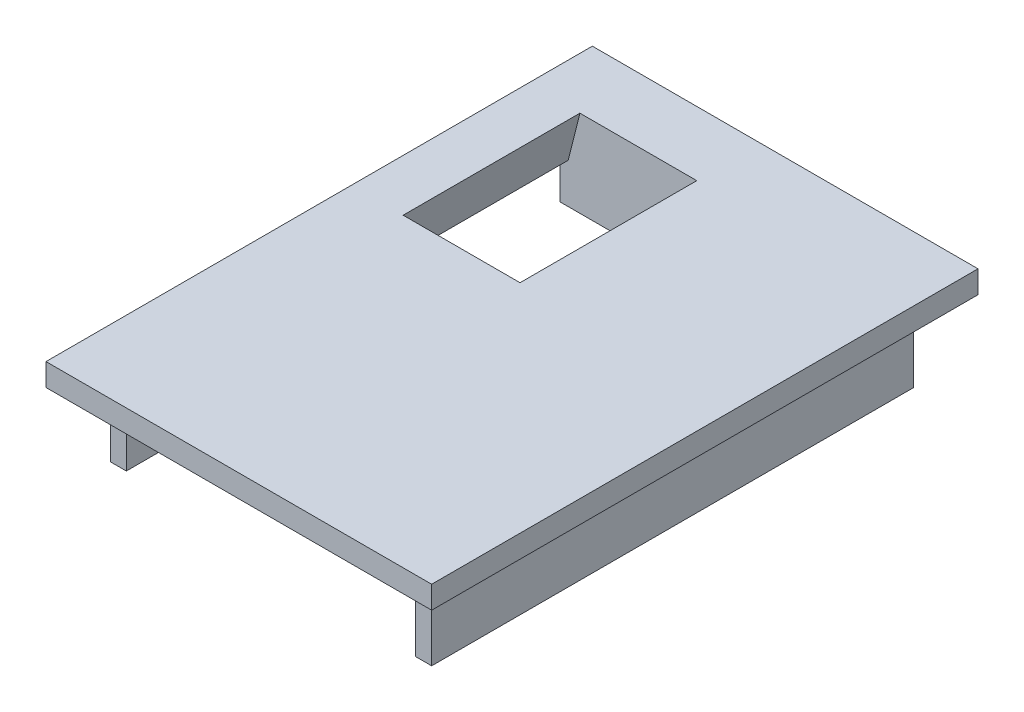
from build123d import *

# Parameters (mm, degrees)
SZKIC1_W                    = 24
SZKIC1_H                    = 34
DODANIE_WYCI_GNI_CIE1_DEPTH = 1.4
SZKIC2_W                    = 20
SZKIC2_H                    = 30
SZKIC2_W_2                  = 16
SZKIC2_H_2                  = 26
DODANIE_WYCI_GNI_CIE2_DEPTH = 4
SZKIC3_W                    = 6.5
SZKIC3_H                    = 11
WYTNIJ_WYCI_GNI_CIE1_DEPTH  = 22.1896201
SZKIC4_W                    = 18
SZKIC4_H                    = 3
WYTNIJ_WYCI_GNI_CIE2_DEPTH  = 2
SZKIC5_W                    = 11
SZKIC5_H                    = 2.5
WYTNIJ_WYCI_GNI_CIE3_DEPTH  = 2
SFAZOWANIE1_SIZE            = 1.5
SFAZOWANIE1_SIZE_2          = 6
DODANIE_WYCI_GNI_CIE3_DEPTH = 1


with BuildPart() as part:
    # Szkic1 → Dodanie-wyciągnięcie1 (new body)
    with BuildSketch(Plane(origin=(0, 0, 0), x_dir=(1, 0, 0), z_dir=(0, 1, 0))):
        Rectangle(SZKIC1_W, SZKIC1_H)
    extrude(amount=DODANIE_WYCI_GNI_CIE1_DEPTH)

    # Szkic2 → Dodanie-wyciągnięcie2 (add)
    with BuildSketch(Plane.XZ):
        Rectangle(SZKIC2_W, SZKIC2_H)
        Rectangle(SZKIC2_W_2, SZKIC2_H_2, mode=Mode.SUBTRACT)
    extrude(amount=DODANIE_WYCI_GNI_CIE2_DEPTH)

    # Szkic3 → Wytnij-wyciągnięcie1 (cut, through all)
    with BuildSketch(Plane.XZ):
        with Locations((-4.75, -7.5)):
            Rectangle(SZKIC3_W, SZKIC3_H)
    extrude(amount=-WYTNIJ_WYCI_GNI_CIE1_DEPTH, mode=Mode.SUBTRACT)

    # Szkic4 → Wytnij-wyciągnięcie2 (cut)
    with BuildSketch(Plane.XY.offset(15)):
        with Locations((0, -2.5)):
            Rectangle(SZKIC4_W, SZKIC4_H)
    extrude(amount=-WYTNIJ_WYCI_GNI_CIE2_DEPTH, mode=Mode.SUBTRACT)

    # Szkic5 → Wytnij-wyciągnięcie3 (cut)
    with BuildSketch(Plane.ZY.offset(10)):
        with Locations((-7.5, -2.75)):
            Rectangle(SZKIC5_W, SZKIC5_H)
    extrude(amount=-WYTNIJ_WYCI_GNI_CIE3_DEPTH, mode=Mode.SUBTRACT)

    # Sfazowanie1
    # the kernel refuses this chamfer: 6, 1.5 mm, written as the material it takes off along each edge
    with BuildSketch(Plane(origin=(-8, -1.5, -13), x_dir=(-0.9890197255468893, -0.14778356633657133, 0), z_dir=(0, 0, 1))) as sfazowanie1_piece_1:
        Polygon((SFAZOWANIE1_SIZE * 0.989019725547, -SFAZOWANIE1_SIZE * 0.147783566337), (-SFAZOWANIE1_SIZE_2 * 0.147783566337, -SFAZOWANIE1_SIZE_2 * 0.989019725547), (0, 0), align=None)
    extrude(amount=11, mode=Mode.SUBTRACT)

    # Szkic6 → Dodanie-wyciągnięcie3 (add)
    with BuildSketch(Plane.XZ.offset(4)):
        Polygon((10, -15), (8, -15), (8, 13), (9, 13), (9, 15), (10, 15), (10, 13), align=None)
    extrude(amount=DODANIE_WYCI_GNI_CIE3_DEPTH)


solid = part.part
